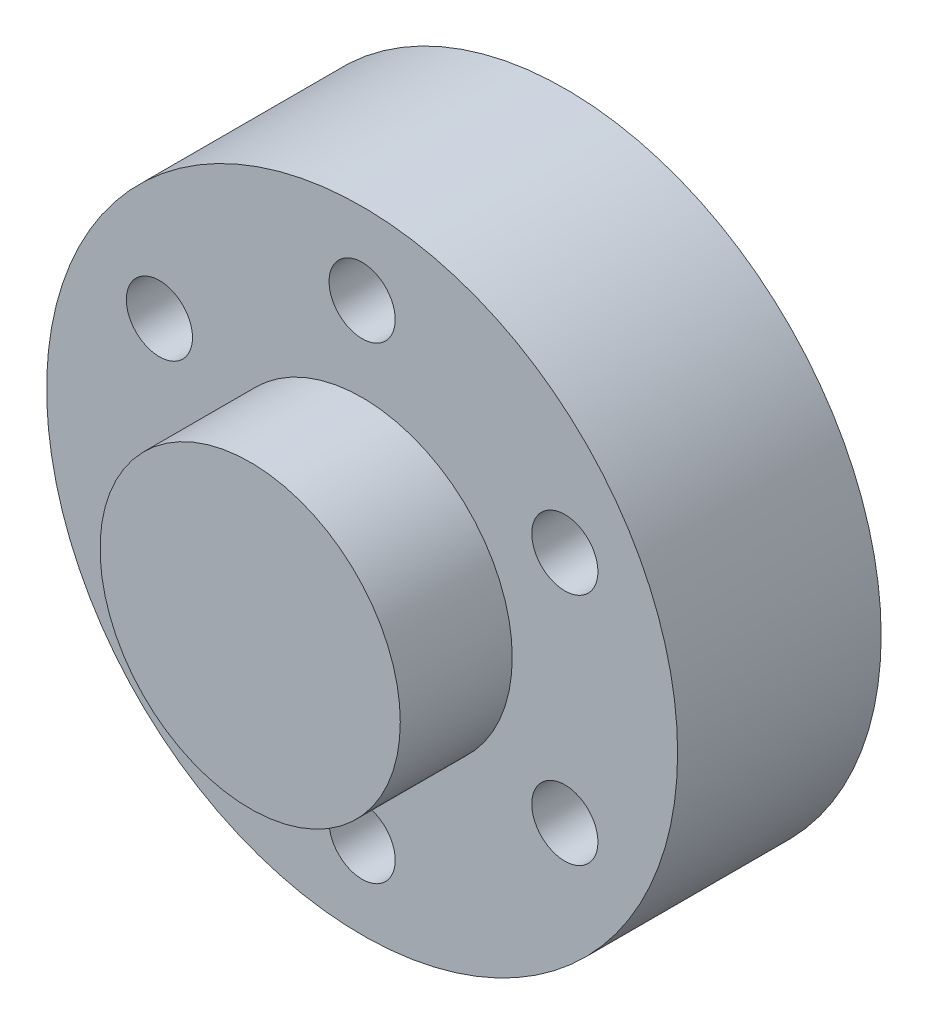
from build123d import *

# Parameters (mm, degrees)
SKETCH2_R           = 15.5
SKETCH2_R_2         = 1.625
BOSS_EXTRUDE1_DEPTH = 10
SKETCH3_R           = 7.375
BOSS_EXTRUDE2_DEPTH = 5.5
BOSS_EXTRUDE4_START = 5.5
SKETCH6_R           = 7.375
BOSS_EXTRUDE4_DEPTH = 5.5
SKETCH7_R           = 2
BOSS_EXTRUDE5_DEPTH = 1
FILLET2_R           = 0.05
CUT_EXTRUDE1_DEPTH  = 11


with BuildPart() as part:
    # Sketch2 → Boss-Extrude1 (new body)
    with BuildSketch(Plane.XY):
        Circle(SKETCH2_R)
        with Locations((0, -11.5)):
            Circle(SKETCH2_R_2, mode=Mode.SUBTRACT)
        with Locations((-9.959292144, -5.75)):
            Circle(SKETCH2_R_2, mode=Mode.SUBTRACT)
        with Locations((9.959292144, -5.75)):
            Circle(SKETCH2_R_2, mode=Mode.SUBTRACT)
        with Locations((-9.959292144, 5.75)):
            Circle(SKETCH2_R_2, mode=Mode.SUBTRACT)
        with Locations((0, 11.5)):
            Circle(SKETCH2_R_2, mode=Mode.SUBTRACT)
        with Locations((9.959292144, 5.75)):
            Circle(SKETCH2_R_2, mode=Mode.SUBTRACT)
    extrude(amount=BOSS_EXTRUDE1_DEPTH)

    # Sketch3 → Boss-Extrude2 (add)
    with BuildSketch(Plane.XY.offset(10)):
        Circle(SKETCH3_R)
    extrude(amount=BOSS_EXTRUDE2_DEPTH)

    # Sketch6 → Boss-Extrude4 (add)
    with BuildSketch(Plane(origin=(0, 0, 0), x_dir=(-1, 0, 0), z_dir=(0, 0, -1)).offset(BOSS_EXTRUDE4_START)):
        Circle(SKETCH6_R)
    extrude(amount=-BOSS_EXTRUDE4_DEPTH)

    # Sketch7 → Boss-Extrude5 (add)
    with BuildSketch(Plane(origin=(0, 0, -5.5), x_dir=(-1, 0, 0), z_dir=(0, 0, -1))):
        Circle(SKETCH7_R)
    extrude(amount=BOSS_EXTRUDE5_DEPTH)

    # Fillet2
    fillet2_edges = [part.edges().sort_by_distance(p)[0] for p in [
        (2, 0, -6.5),
    ]]
    fillet(fillet2_edges, radius=FILLET2_R)

    # Sketch9 → Cut-Extrude1 (cut)
    with BuildSketch(Plane(origin=(0, 0, -6.5), x_dir=(-1, 0, 0), z_dir=(0, 0, -1))):
        with BuildLine():
            Line((-1.224744871, 1.25), (1.224744871, 1.25))
            ThreePointArc((1.224744871, 1.25), (0, -1.75), (-1.224744871, 1.25))
        make_face()
    extrude(amount=-CUT_EXTRUDE1_DEPTH, mode=Mode.SUBTRACT)


solid = part.part
